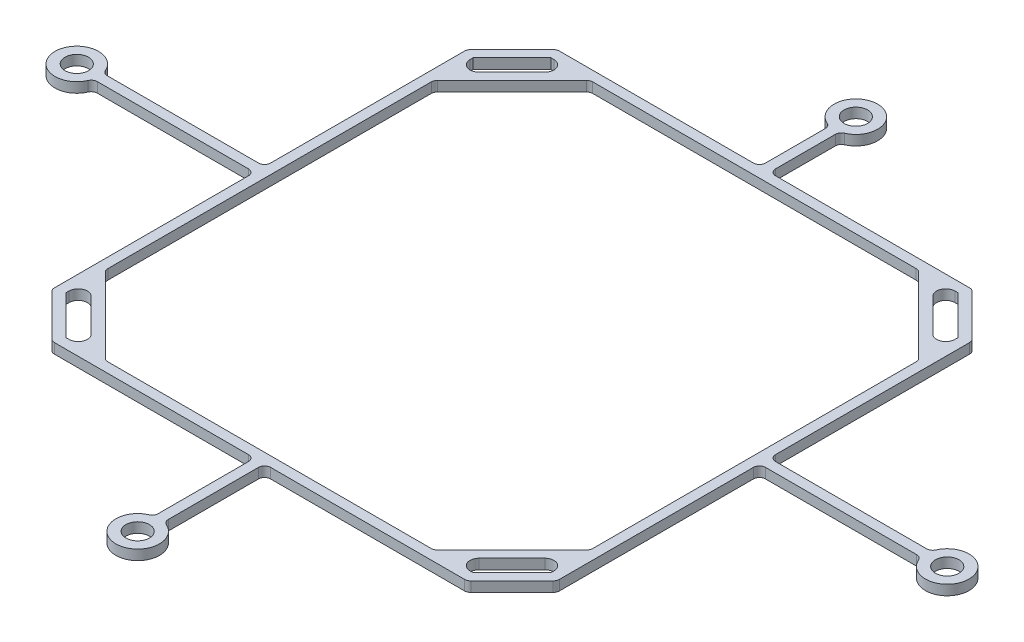
from build123d import *

# Parameters (mm, degrees)
SKETCH1_R           = 1.925
BOSS_EXTRUDE1_DEPTH = 1.65
FILLET4_R           = 1
FILLET3_R           = 1.5
FILLET5_R           = 1


with BuildPart() as part:
    # Sketch1 → Boss-Extrude1 (new body)
    with BuildSketch(Plane(origin=(0, 0, 0), x_dir=(1, 0, 0), z_dir=(0, 1, 0))):
        with BuildLine():
            Line((-41.448800006, 34.091704203), (-34.091704203, 41.448800006))
            Line((-34.091704203, 41.448800006), (-0.825, 41.448800006))
            Line((-0.825, 41.448800006), (-0.825, 52.97029458))
            ThreePointArc((-0.825, 52.97029458), (0, 60.023800006), (0.825, 52.97029458))
            Line((0.825, 52.97029458), (0.825, 41.448800006))
            Line((0.825, 41.448800006), (34.091704203, 41.448800006))
            Line((34.091704203, 41.448800006), (41.448800006, 34.091704203))
            Line((41.448800006, 34.091704203), (41.448800006, 0.825))
            Line((41.448800006, 0.825), (67.97029458, 0.825))
            ThreePointArc((67.97029458, 0.825), (75.023800006, 0), (67.97029458, -0.825))
            Line((67.97029458, -0.825), (41.448800006, -0.825))
            Line((41.448800006, -0.825), (41.448800006, -34.091704203))
            Line((41.448800006, -34.091704203), (34.091704203, -41.448800006))
            Line((34.091704203, -41.448800006), (0.825, -41.448800006))
            Line((0.825, -41.448800006), (0.825, -57.97029458))
            ThreePointArc((0.825, -57.97029458), (0, -65.023800006), (-0.825, -57.97029458))
            Line((-0.825, -57.97029458), (-0.825, -41.448800006))
            Line((-0.825, -41.448800006), (-34.091704203, -41.448800006))
            Line((-34.091704203, -41.448800006), (-41.448800006, -34.091704203))
            Line((-41.448800006, -34.091704203), (-41.448800006, -0.825))
            Line((-41.448800006, -0.825), (-67.97029458, -0.825))
            ThreePointArc((-67.97029458, -0.825), (-75.023800006, 0), (-67.97029458, 0.825))
            Line((-67.97029458, 0.825), (-41.448800006, 0.825))
            Line((-41.448800006, 0.825), (-41.448800006, 34.091704203))
        make_face()
        with Locations((0, 56.448800006)):
            Circle(SKETCH1_R, mode=Mode.SUBTRACT)
        with Locations((71.448800006, 0)):
            Circle(SKETCH1_R, mode=Mode.SUBTRACT)
        with Locations((0, -61.448800006)):
            Circle(SKETCH1_R, mode=Mode.SUBTRACT)
        with Locations((-71.448800006, 0)):
            Circle(SKETCH1_R, mode=Mode.SUBTRACT)
        Polygon((-39.798800006, 33.408251825), (-33.408251825, 39.798800006), (-29.292890359, 39.798800006), (-39.798800006, 29.292890359), align=None, mode=Mode.SUBTRACT)
        Polygon((-33.408251825, -39.798800006), (-29.292890359, -39.798800006), (-39.798800006, -29.292890359), (-39.798800006, -33.408251825), align=None, mode=Mode.SUBTRACT)
        Polygon((39.798800006, -33.408251825), (39.798800006, -29.292890359), (29.292890359, -39.798800006), (33.408251825, -39.798800006), align=None, mode=Mode.SUBTRACT)
        Polygon((33.408251825, 39.798800006), (39.798800006, 33.408251825), (39.798800006, 29.292890359), (29.292890359, 39.798800006), align=None, mode=Mode.SUBTRACT)
        Polygon((-39.798800006, 26.959437981), (-26.959437981, 39.798800006), (26.959437981, 39.798800006), (39.798800006, 26.959437981), (39.798800006, -26.959437981), (26.959437981, -39.798800006), (-26.959437981, -39.798800006), (-39.798800006, -26.959437981), align=None, mode=Mode.SUBTRACT)
    extrude(amount=BOSS_EXTRUDE1_DEPTH)

    # Fillet4
    fillet4_edges = [part.edges().sort_by_distance(p)[0] for p in [
        (0.825, 0.825, -41.448800006),
        (0.825, 0.825, -52.97029458),
        (-0.825, 0.825, -52.97029458),
        (-0.825, 0.825, -41.448800006),
        (67.97029458, 0.825, -0.825),
        (67.97029458, 0.825, 0.825),
        (41.448800006, 0.825, -0.825),
        (41.448800006, 0.825, 0.825),
        (0.825, 0.825, 57.97029458),
        (-0.825, 0.825, 57.97029458),
        (-0.825, 0.825, 41.448800006),
        (0.825, 0.825, 41.448800006),
        (-41.448800006, 0.825, 0.825),
        (-41.448800006, 0.825, -0.825),
        (-67.97029458, 0.825, 0.825),
        (-67.97029458, 0.825, -0.825),
    ]]
    fillet(fillet4_edges, radius=FILLET4_R)

    # Fillet3
    fillet3_edges = [part.edges().sort_by_distance(p)[0] for p in [
        (29.292890359, 0.825, 39.798800006),
        (39.798800006, 0.825, 29.292890359),
        (-29.292890359, 0.825, 39.798800006),
        (-39.798800006, 0.825, 29.292890359),
        (-39.798800006, 0.825, -29.292890359),
        (-29.292890359, 0.825, -39.798800006),
        (39.798800006, 0.825, -29.292890359),
        (29.292890359, 0.825, -39.798800006),
    ]]
    fillet(fillet3_edges, radius=FILLET3_R)

    # Fillet5
    fillet5_edges = [part.edges().sort_by_distance(p)[0] for p in [
        (-26.959437981, 0.825, 39.798800006),
        (-39.798800006, 0.825, 26.959437981),
        (-41.448800006, 0.825, 34.091704203),
        (-34.091704203, 0.825, 41.448800006),
        (-39.798800006, 0.825, -26.959437981),
        (-26.959437981, 0.825, -39.798800006),
        (-41.448800006, 0.825, -34.091704203),
        (-34.091704203, 0.825, -41.448800006),
        (41.448800006, 0.825, -34.091704203),
        (34.091704203, 0.825, -41.448800006),
        (26.959437981, 0.825, -39.798800006),
        (39.798800006, 0.825, -26.959437981),
        (34.091704203, 0.825, 41.448800006),
        (41.448800006, 0.825, 34.091704203),
        (39.798800006, 0.825, 26.959437981),
        (26.959437981, 0.825, 39.798800006),
    ]]
    fillet(fillet5_edges, radius=FILLET5_R)


solid = part.part
